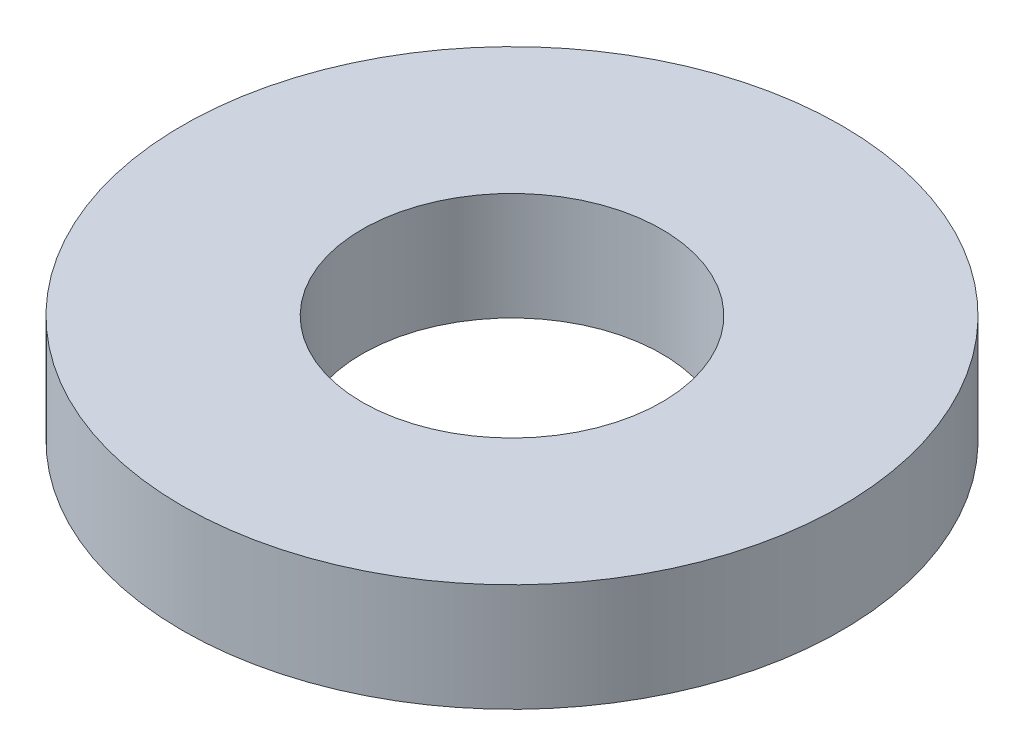
from build123d import *

# Parameters (mm, degrees)
SKETCH1_R           = 82.5
BOSS_EXTRUDE1_DEPTH = 27
SKETCH2_R           = 37.5
CUT_EXTRUDE1_DEPTH  = 120.756001937


with BuildPart() as part:
    # Sketch1 → Boss-Extrude1 (new body)
    with BuildSketch(Plane(origin=(0, 0, 0), x_dir=(1, 0, 0), z_dir=(0, 1, 0))):
        Circle(SKETCH1_R)
    extrude(amount=BOSS_EXTRUDE1_DEPTH)

    # Sketch2 → Cut-Extrude1 (cut, through all)
    with BuildSketch(Plane(origin=(0, 0, 0), x_dir=(1, 0, 0), z_dir=(0, 1, 0))):
        Circle(SKETCH2_R)
    extrude(amount=CUT_EXTRUDE1_DEPTH, mode=Mode.SUBTRACT)


solid = part.part
